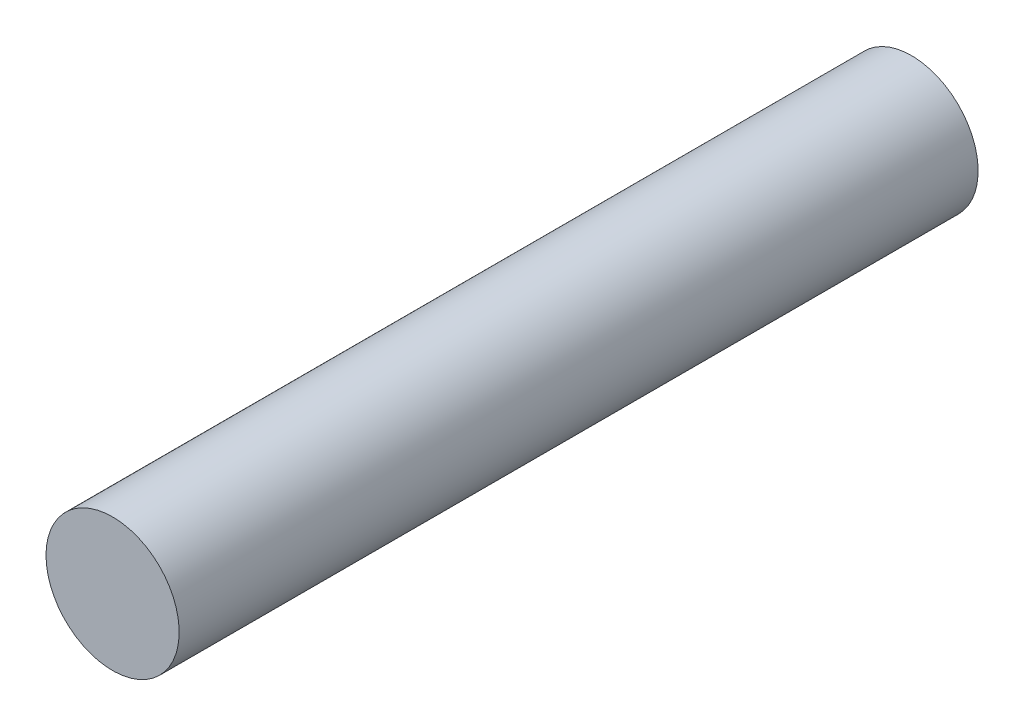
from build123d import *

# Parameters (mm, degrees)
SKETCH1_R           = 3.175
BOSS_EXTRUDE1_DEPTH = 19.05


with BuildPart() as part:
    # Sketch1 → Boss-Extrude1 (new, symmetric)
    with BuildSketch(Plane.XY):
        Circle(SKETCH1_R)
    extrude(amount=BOSS_EXTRUDE1_DEPTH, both=True)


solid = part.part
